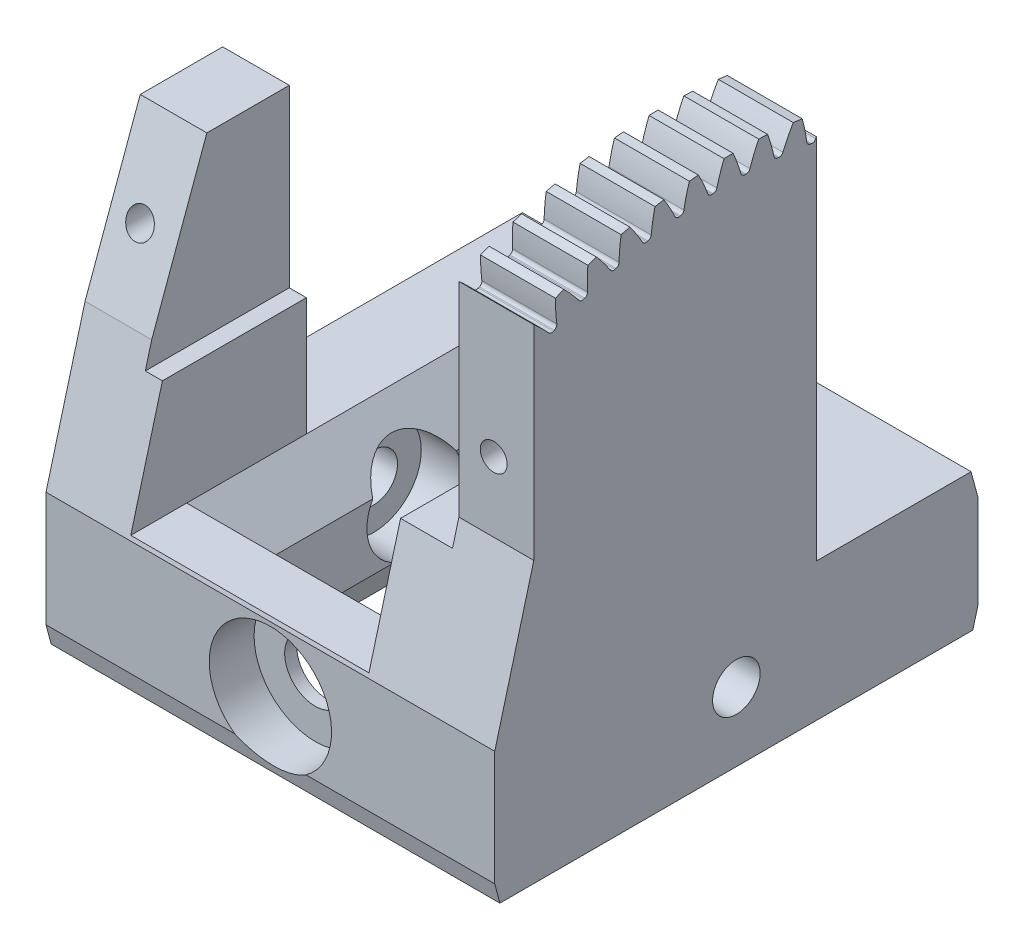
from build123d import *
from OCP.BRepFilletAPI import BRepFilletAPI_MakeChamfer

# Parameters (mm, degrees)
SKETCH1_W           = 33.02
SKETCH1_H           = 35.56
SKETCH1_W_2         = 14.351
SKETCH1_H_2         = 27.178
BOSS_EXTRUDE1_DEPTH = 10.16
SKETCH2_R           = 2.25
CUT_EXTRUDE1_DEPTH  = 41.500855547
SKETCH3_R           = 1.75
CUT_EXTRUDE2_DEPTH  = 39.854528694
SKETCH8_R           = 4.5
CUT_EXTRUDE5_DEPTH  = 3.302
SKETCH4_W           = 4.9022
SKETCH4_H           = 13
SKETCH4_W_2         = 5.5118
BOSS_EXTRUDE2_DEPTH = 21.59
CHAMFER5_SIZE       = 3.175
CHAMFER5_SIZE_2     = 3.404770654
SKETCH15_W          = 1.2573
SKETCH15_H          = 13
SKETCH15_W_2        = 3.8227
BOSS_EXTRUDE3_DEPTH = 8.684
CHAMFER7_SIZE       = 1.905
CHAMFER7_SIZE2      = 0.693363296
SKETCH16_R          = 0.9906
CUT_EXTRUDE6_DEPTH  = 43.303619231
CHAMFER8_SIZE       = 19.05
CHAMFER8_SIZE_2     = 6.933632963
CHAMFER9_SIZE       = 0.381
CHAMFER9_SIZE_2     = 1.421911358
CHAMFER10_SIZE      = 0.510443212
CHAMFER10_SIZE_2    = 1.905
CUT_EXTRUDE7_DEPTH  = 50.13767699
BOSS_EXTRUDE4_DEPTH = 5.5118
CUT_EXTRUDE8_START  = -5.5118
CUT_EXTRUDE8_DEPTH  = 5.5118
SKETCH20_W          = 10.668
SKETCH20_H          = 24.13
BOSS_EXTRUDE5_DEPTH = 0.635
SKETCH25_R          = 0.9906
CUT_EXTRUDE12_DEPTH = 49.155866355
SKETCH26_R          = 3.5
CUT_EXTRUDE13_DEPTH = 3
CUT_EXTRUDE15_START = -3
SKETCH27_R          = 3.5
CUT_EXTRUDE15_DEPTH = 3


# Read off the part's stored shape, not the designer's step: Cut-Extrude8
with BuildPart() as part:
    # Sketch1 → Boss-Extrude1 (new body)
    with BuildSketch(Plane(origin=(0, 0, 0), x_dir=(1, 0, 0), z_dir=(0, 1, 0))):
        Rectangle(SKETCH1_W, SKETCH1_H)
        Rectangle(SKETCH1_W_2, SKETCH1_H_2, mode=Mode.SUBTRACT)
    extrude(amount=BOSS_EXTRUDE1_DEPTH)

    # Sketch2 → Cut-Extrude1 (cut, through all)
    with BuildSketch(Plane.XY.offset(17.78)):
        with Locations((0, 5.08)):
            Circle(SKETCH2_R)
    extrude(amount=-CUT_EXTRUDE1_DEPTH, mode=Mode.SUBTRACT)

    # Sketch3 → Cut-Extrude2 (cut, through all)
    with BuildSketch(Plane.ZY.offset(16.51)):
        with Locations((0, 5.08)):
            Circle(SKETCH3_R)
    extrude(amount=-CUT_EXTRUDE2_DEPTH, mode=Mode.SUBTRACT)

    # Sketch8 → Cut-Extrude5 (cut)
    with BuildSketch(Plane(origin=(0, 0, -17.78), x_dir=(-1, 0, 0), z_dir=(0, 0, -1))):
        with Locations((0, 5.08)):
            Circle(SKETCH8_R)
    cut_extrude5 = extrude(amount=-CUT_EXTRUDE5_DEPTH, mode=Mode.SUBTRACT)

    # Sketch4 → Boss-Extrude2 (add)
    with BuildSketch(Plane(origin=(0, 10.16, 0), x_dir=(1, 0, 0), z_dir=(0, 1, 0))):
        with Locations((-14.0589, -11.28)):
            Rectangle(SKETCH4_W, SKETCH4_H)
        with Locations((13.7541, -11.28)):
            Rectangle(SKETCH4_W_2, SKETCH4_H)
    extrude(amount=BOSS_EXTRUDE2_DEPTH)

    # Mirror2: Cut-Extrude5 across plane
    add(cut_extrude5.mirror(Plane.XY), mode=Mode.SUBTRACT)

    # Chamfer5
    # the kernel refuses this chamfer: 3.404770654, 3.175 mm, written as the material it takes off along each edge
    with BuildSketch(Plane(origin=(-7.1755, 10.16, 13.589), x_dir=(-0.999535821028092, 0.03046543092913525, 0), z_dir=(0, 0, -1))) as chamfer5_piece_1:
        Polygon((CHAMFER5_SIZE * 0.999535821028, -CHAMFER5_SIZE * 0.0304654309291), (-CHAMFER5_SIZE_2 * 0.0304654309321, -CHAMFER5_SIZE_2 * 0.999535821124), (0, 0), align=None)
    extrude(amount=27.178, mode=Mode.SUBTRACT)

    # Sketch15 → Boss-Extrude3 (add)
    with BuildSketch(Plane(origin=(0, 10.16, 0), x_dir=(1, 0, 0), z_dir=(0, 1, 0))):
        with Locations((-10.97915, -11.28)):
            Rectangle(SKETCH15_W, SKETCH15_H)
        with Locations((9.08685, -11.28)):
            Rectangle(SKETCH15_W_2, SKETCH15_H)
    extrude(amount=BOSS_EXTRUDE3_DEPTH)

    # Chamfer7: one chamfer whose edges measure the first distance from different faces: ONE call of the kernel's chamfer builder (chamfer() names one face for all edges)
    chamfer7_edges_1 = [part.edges().sort_by_distance(p)[0] for p in [
        (7.1755, 0, 0),
    ]]
    chamfer7_side_1 = [part.faces().sort_by_distance(p)[0] for p in [
        (7.1755, 7.883558881, 3.356415217),
    ]]
    chamfer7_edges_2 = [part.edges().sort_by_distance(p)[0] for p in [
        (-7.1755, 0, 0),
    ]]
    chamfer7_side_2 = [part.faces().sort_by_distance(p)[0] for p in [
        (-7.1755, 3.284488003, 0),
    ]]
    chamfer7 = BRepFilletAPI_MakeChamfer(part.part.solid().wrapped)
    for e in chamfer7_edges_1:
        chamfer7.Add(CHAMFER7_SIZE, CHAMFER7_SIZE2, e.wrapped, chamfer7_side_1[0].wrapped)  # the first distance lies on this face
    for e in chamfer7_edges_2:
        chamfer7.Add(CHAMFER7_SIZE, CHAMFER7_SIZE2, e.wrapped, chamfer7_side_2[0].wrapped)  # the first distance lies on this face
    add(Compound.cast(chamfer7.Shape()), mode=Mode.REPLACE)

    # Sketch16 → Cut-Extrude6 (cut, through all)
    with BuildSketch(Plane(origin=(0, 0, 4.78), x_dir=(-1, 0, 0), z_dir=(0, 0, -1))):
        with Locations((14.33195, 25.725)):
            Circle(SKETCH16_R)
        with Locations((-13.56195, 25.725)):
            Circle(SKETCH16_R)
    extrude(amount=-CUT_EXTRUDE6_DEPTH, mode=Mode.SUBTRACT)

    # Chamfer8
    # the kernel refuses this chamfer: 19.05, 6.933632963 mm, written as the material it takes off along each edge
    with BuildSketch(Plane(origin=(65.929409655, 31.75, 17.78), x_dir=(0, -0.9999130865277315, 0.0131840581986459), z_dir=(-1, 0, 0))) as chamfer8_piece_1:
        Polygon((CHAMFER8_SIZE * 0.999913086528, -CHAMFER8_SIZE * 0.0131840581986), (-CHAMFER8_SIZE_2 * 0.0131840581982, -CHAMFER8_SIZE_2 * 0.999913086495), (0, 0), align=None)
    extrude(amount=104.35061931, mode=Mode.SUBTRACT)
    with BuildSketch(Plane(origin=(37.811609655, 31.75, 17.78), x_dir=(0, -0.9999130865277315, 0.0131840581986459), z_dir=(-1, 0, 0))) as chamfer8_piece_2:
        Polygon((CHAMFER8_SIZE * 0.999913086528, -CHAMFER8_SIZE * 0.0131840581986), (-CHAMFER8_SIZE_2 * 0.0131840581982, -CHAMFER8_SIZE_2 * 0.999913086495), (0, 0), align=None)
    extrude(amount=103.74101931, mode=Mode.SUBTRACT)

    # Chamfer9
    # the kernel refuses this chamfer: 1.421911358, 0.381 mm, written as the material it takes off along each edge
    with BuildSketch(Plane(origin=(20.202307893, 0, 17.78), x_dir=(0, -0.13751244702129156, -0.990500038825954), z_dir=(-1, 0, 0)), Plane(origin=(-20.202307893, 0, -17.78), x_dir=(0, -0.13751244702129156, 0.990500038825954), z_dir=(1, 0, 0))) as chamfer9_piece_1:
        Polygon((CHAMFER9_SIZE * 0.990500038826, -CHAMFER9_SIZE * 0.137512447021), (-CHAMFER9_SIZE_2 * 0.137512446991, -CHAMFER9_SIZE_2 * 0.990500038606), (0, 0), align=None)
    extrude(amount=40.404615787, mode=Mode.SUBTRACT)

    # Chamfer10
    # the kernel refuses this chamfer: 1.905, 0.510443212 mm, written as the material it takes off along each edge
    with BuildSketch(Plane(origin=(-21.456754591, 10.16, -17.78), x_dir=(0, 0.1375124470212896, 0.9905000388259544), z_dir=(1, 0, 0))) as chamfer10_piece_1:
        Polygon((CHAMFER10_SIZE * 0.990500038013, CHAMFER10_SIZE * 0.137512446908), (-CHAMFER10_SIZE_2 * 0.137512447021, CHAMFER10_SIZE_2 * 0.990500038826), (0, 0), align=None)
    extrude(amount=42.913509182, mode=Mode.SUBTRACT)

    # Sketch17 → Cut-Extrude7 (cut, through all)
    with BuildSketch(Plane.ZY.offset(16.51)):
        Polygon((17.78, 9.87), (14.905658652, 20.597187951), (17.78, 12.7), align=None)
    extrude(amount=-CUT_EXTRUDE7_DEPTH, mode=Mode.SUBTRACT)

    # Sketch18 → Boss-Extrude4 (add)
    with BuildSketch(Plane(origin=(16.51, 0, 0), x_dir=(0, 0, -1), z_dir=(1, 0, 0))):
        with BuildLine():
            Line((-10.846367037, 31.75), (-4.78, 31.75))
            Line((-4.78, 31.75), (-4.78, 34.29))
            Line((-4.78, 34.29), (5.888, 34.29))
            Line((5.888, 34.29), (5.888, 38.86069798))
            ThreePointArc((5.888, 38.86069798), (-4.736227999, 39.041334549), (-14.905658652, 35.960826416))
            Line((-14.905658652, 35.960826416), (-14.905658652, 20.597187951))
            Line((-14.905658652, 20.597187951), (-10.846367037, 31.75))
        make_face()
    extrude(amount=-BOSS_EXTRUDE4_DEPTH)

    # Cut-Extrude8 outline → Cut-Extrude8 (cut)
    with BuildSketch(Plane(origin=(16.51, 0, 0), x_dir=(0, 0, -1), z_dir=(1, 0, 0)).offset(CUT_EXTRUDE8_START)):
        with BuildLine():
            ThreePointArc((5.431634301, 36.954720994), (5.472941103, 36.947654531), (5.514238712, 36.940534538))
            ThreePointArc((5.514238712, 36.940534538), (5.701437928, 36.967944805), (5.836082728, 37.100856982))
            ThreePointArc((5.836082728, 37.100856982), (5.861931965, 37.150837884), (5.888, 37.200705018))
            Line((5.888, 37.200705018), (5.888, 38.86069798))
            ThreePointArc((5.888, 38.86069798), (-4.736227999, 39.041334549), (-14.905658652, 35.960826416))
            Line((-14.905658652, 35.960826416), (-14.905658652, 35.618569571))
            ThreePointArc((-14.905658652, 35.618569571), (-14.346917288, 35.099757597), (-13.819957647, 34.548693797))
            ThreePointArc((-13.819957647, 34.548693797), (-13.655834746, 34.454573966), (-13.467842814, 34.475878956))
            ThreePointArc((-13.467842814, 34.475878956), (-13.429732852, 34.49330932), (-13.391600332, 34.510690277))
            ThreePointArc((-13.391600332, 34.510690277), (-13.252369834, 34.638790775), (-13.215993174, 34.824456086))
            ThreePointArc((-13.215993174, 34.824456086), (-13.292173518, 35.664524627), (-13.31302819, 36.507782406))
            ThreePointArc((-13.31302819, 36.507782406), (-13.005286181, 36.636374283), (-12.696302289, 36.761952824))
            ThreePointArc((-12.696302289, 36.761952824), (-12.116955476, 36.148865662), (-11.579115997, 35.49906008))
            ThreePointArc((-11.579115997, 35.49906008), (-11.422485601, 35.392938508), (-11.233427209, 35.40013527))
            ThreePointArc((-11.233427209, 35.40013527), (-11.194121237, 35.414668935), (-11.154796462, 35.429151644))
            ThreePointArc((-11.154796462, 35.429151644), (-11.006382319, 35.546489239), (-10.95623259, 35.728916961))
            ThreePointArc((-10.95623259, 35.728916961), (-10.969421517, 36.572329464), (-10.927201143, 37.414787795))
            ThreePointArc((-10.927201143, 37.414787795), (-10.610709959, 37.520022514), (-10.293205553, 37.622159517))
            ThreePointArc((-10.293205553, 37.622159517), (-9.761294773, 36.967492029), (-9.273519234, 36.279310641))
            ThreePointArc((-9.273519234, 36.279310641), (-9.125257283, 36.161780802), (-8.936189721, 36.154829089))
            ThreePointArc((-8.936189721, 36.154829089), (-8.895907555, 36.166384775), (-8.855610446, 36.177888244))
            ThreePointArc((-8.855610446, 36.177888244), (-8.69884265, 36.283806737), (-8.635200308, 36.46197666))
            ThreePointArc((-8.635200308, 36.46197666), (-8.585324061, 37.304016421), (-8.480264754, 38.140963934))
            ThreePointArc((-8.480264754, 38.140963934), (-8.156794344, 38.22225298), (-7.832545037, 38.300377253))
            ThreePointArc((-7.832545037, 38.300377253), (-7.351044949, 37.607790605), (-6.916061189, 36.885082001))
            ThreePointArc((-6.916061189, 36.885082001), (-6.776996825, 36.75680117), (-6.588977437, 36.735739858))
            ThreePointArc((-6.588977437, 36.735739858), (-6.547944351, 36.744252943), (-6.506900265, 36.752712839))
            ThreePointArc((-6.506900265, 36.752712839), (-6.342655524, 36.846619889), (-6.265876484, 37.019535615))
            ThreePointArc((-6.265876484, 37.019535615), (-6.153213991, 37.855493605), (-5.985903285, 38.682249752))
            ThreePointArc((-5.985903285, 38.682249752), (-5.657262626, 38.739138523), (-5.328081751, 38.792813164))
            ThreePointArc((-5.328081751, 38.792813164), (-4.8996851, 38.066180583), (-4.519925725, 37.312986441))
            ThreePointArc((-4.519925725, 37.312986441), (-4.390836651, 37.174672016), (-4.204916917, 37.13961889))
            ThreePointArc((-4.204916917, 37.13961889), (-4.163362384, 37.145041764), (-4.121800857, 37.150410776))
            ThreePointArc((-4.121800857, 37.150410776), (-3.950997695, 37.231781218), (-3.861511337, 37.398475732))
            ThreePointArc((-3.861511337, 37.398475732), (-3.686692652, 38.223676935), (-3.458066217, 39.03561816))
            ThreePointArc((-3.458066217, 39.03561816), (-3.1260932, 39.067788511), (-2.793821671, 39.096713348))
            ThreePointArc((-2.793821671, 39.096713348), (-2.420924225, 38.340098457), (-2.098513003, 37.560630946))
            ThreePointArc((-2.098513003, 37.560630946), (-1.980121139, 37.413056437), (-1.797340797, 37.364207528))
            ThreePointArc((-1.797340797, 37.364207528), (-1.755497206, 37.366509864), (-1.713650667, 37.368757967))
            ThreePointArc((-1.713650667, 37.368757967), (-1.537244285, 37.437136745), (-1.435551052, 37.596677823))
            ThreePointArc((-1.435551052, 37.596677823), (-1.199553833, 38.406507379), (-0.91089024, 39.199092976))
            ThreePointArc((-0.91089024, 39.199092976), (-0.577441394, 39.206364998), (-0.243937407, 39.210378274))
            ThreePointArc((-0.243937407, 39.210378274), (0.07137544, 38.42801237), (0.334635456, 37.626630587))
            ThreePointArc((0.334635456, 37.626630587), (0.441668016, 37.470621292), (0.620286783, 37.408249782))
            ThreePointArc((0.620286783, 37.408249782), (0.662185424, 37.407418705), (0.704082952, 37.406533325))
            ThreePointArc((0.704082952, 37.406533325), (0.885106019, 37.461538037), (0.998437417, 37.613033461))
            ThreePointArc((0.998437417, 37.613033461), (1.294293378, 38.402962476), (1.641379805, 39.171759985))
            ThreePointArc((1.641379805, 39.171759985), (1.9744397, 39.15409301), (2.307311054, 39.133172279))
            ThreePointArc((2.307311054, 39.133172279), (2.563275946, 38.329430671), (2.765912497, 37.510616268))
            ThreePointArc((2.765912497, 37.510616268), (2.860987183, 37.347044653), (3.034445467, 37.271499349))
            ThreePointArc((3.034445467, 37.271499349), (3.076164844, 37.267539507), (3.117879054, 37.263525597))
            ThreePointArc((3.117879054, 37.263525597), (3.302506451, 37.304848633), (3.426842218, 37.447451179))
            ThreePointArc((3.426842218, 37.447451179), (3.780902376, 38.213062048), (4.184470589, 38.953772043))
            ThreePointArc((4.184470589, 38.953772043), (4.515278925, 38.911264871), (4.845656095, 38.865527132))
            ThreePointArc((4.845656095, 38.865527132), (5.040841572, 38.044904668), (5.181721433, 37.213236787))
            ThreePointArc((5.181721433, 37.213236787), (5.264306549, 37.043017612), (5.431634301, 36.954720994))
        make_face()
    extrude(amount=CUT_EXTRUDE8_DEPTH, mode=Mode.SUBTRACT)

    # Sketch20 → Boss-Extrude5 (add)
    with BuildSketch(Plane(origin=(16.51, 0, 0), x_dir=(0, 0, -1), z_dir=(1, 0, 0))):
        with Locations((0.554, 22.225)):
            Rectangle(SKETCH20_W, SKETCH20_H)
    extrude(amount=-BOSS_EXTRUDE5_DEPTH)

    # Sketch25 → Cut-Extrude12 (cut, through all)
    with BuildSketch(Plane(origin=(0, 0, 4.78), x_dir=(-1, 0, 0), z_dir=(0, 0, -1))):
        with Locations((-13.56195, 25.725)):
            Circle(SKETCH25_R)
    extrude(amount=-CUT_EXTRUDE12_DEPTH, mode=Mode.SUBTRACT)

    # Sketch26 → Cut-Extrude13 (cut)
    with BuildSketch(Plane(origin=(-7.1755, 0, 0), x_dir=(0, 0, -1), z_dir=(1, 0, 0))):
        with Locations((0, 5.08)):
            Circle(SKETCH26_R)
    extrude(amount=-CUT_EXTRUDE13_DEPTH, mode=Mode.SUBTRACT)

    # Sketch27 → Cut-Extrude15 (cut)
    with BuildSketch(Plane.ZY.offset(-7.1755).offset(CUT_EXTRUDE15_START)):
        with Locations(Location((0, 5.08, 0), (0, 0, 180))):
            Circle(SKETCH27_R)
    extrude(amount=CUT_EXTRUDE15_DEPTH, mode=Mode.SUBTRACT)


solid = part.part
